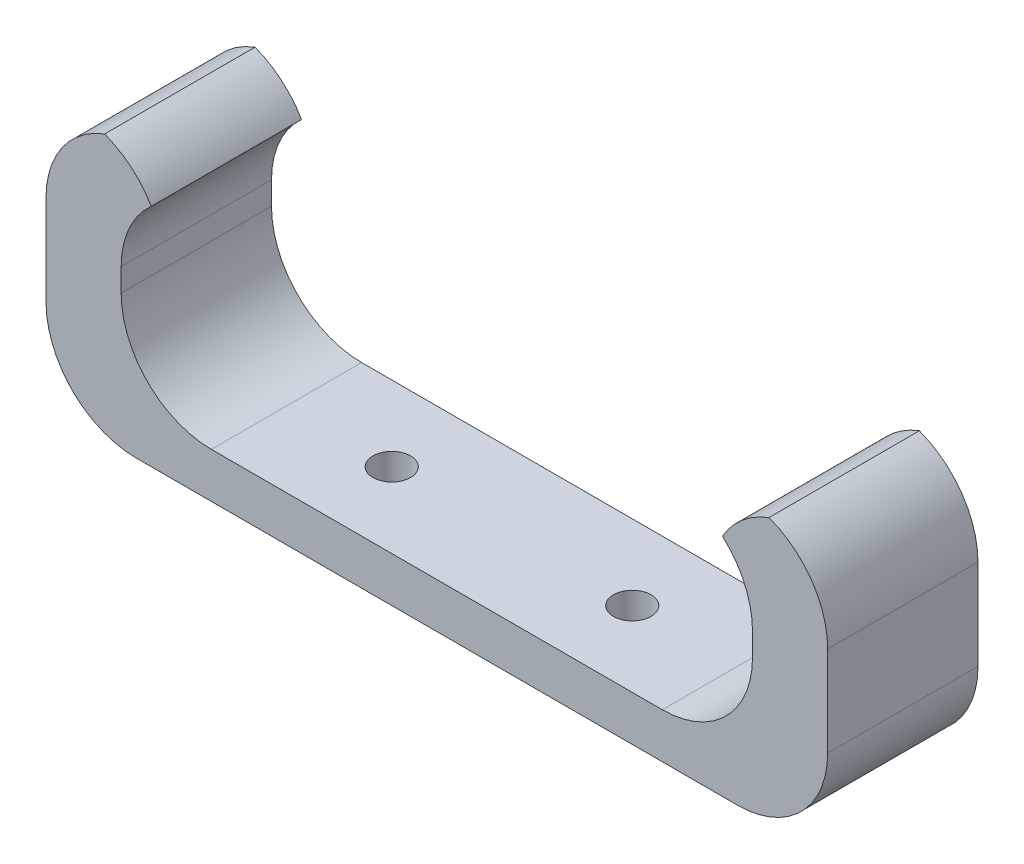
from build123d import *

# Parameters (mm, degrees)
SKETCH1_W           = 42
SKETCH1_H           = 10
SKETCH1_R           = 1.25
BOSS_EXTRUDE1_DEPTH = 3
SKETCH2_W           = 5
SKETCH2_H           = 10
BOSS_EXTRUDE2_DEPTH = 18
SKETCH3_W           = 10
SKETCH3_H           = 3
BOSS_EXTRUDE3_DEPTH = 2
SKETCH4_W           = 10
SKETCH4_H           = 3
BOSS_EXTRUDE4_DEPTH = 2
FILLET1_R           = 6


with BuildPart() as part:
    # Sketch1 → Boss-Extrude1 (new body)
    with BuildSketch(Plane(origin=(0, 0, 0), x_dir=(1, 0, 0), z_dir=(0, 1, 0))):
        with Locations((8, 0)):
            Rectangle(SKETCH1_W, SKETCH1_H)
        with Locations(Location((0, 0, 0), (0, 0, 270))):
            Circle(SKETCH1_R, mode=Mode.SUBTRACT)
        with Locations(Location((16, 0, 0), (0, 0, 270))):
            Circle(SKETCH1_R, mode=Mode.SUBTRACT)
    extrude(amount=BOSS_EXTRUDE1_DEPTH)

    # Sketch2 → Boss-Extrude2 (add)
    with BuildSketch(Plane.XZ):
        with Locations((-15.5, 0)):
            Rectangle(SKETCH2_W, SKETCH2_H)
        with Locations((31.5, 0)):
            Rectangle(SKETCH2_W, SKETCH2_H)
    extrude(amount=-BOSS_EXTRUDE2_DEPTH)

    # Sketch3 → Boss-Extrude3 (add)
    with BuildSketch(Plane(origin=(-13, 0, 0), x_dir=(0, 0, -1), z_dir=(1, 0, 0))):
        with Locations((0, 16.5)):
            Rectangle(SKETCH3_W, SKETCH3_H)
    extrude(amount=BOSS_EXTRUDE3_DEPTH)

    # Sketch4 → Boss-Extrude4 (add)
    with BuildSketch(Plane.ZY.offset(-29)):
        with Locations((0, 16.5)):
            Rectangle(SKETCH4_W, SKETCH4_H)
    extrude(amount=BOSS_EXTRUDE4_DEPTH)

    # Fillet1
    # the kernel refuses this fillet: 6 mm, written as the material it adds along each edge
    with BuildSketch(Plane(origin=(29, 15, 5), x_dir=(-1, 0, 0), z_dir=(0, 0, -1))) as fillet1_piece_1:
        with BuildLine():
            CenterArc((6, -4.472135955), FILLET1_R, 131.810314896, 48.189685104)
            Line((0, -4.472135955), (-0.12, -4.472135955))
            Line((-0.12, -4.472135955), (-0.12, 0))
            Line((-0.12, 0), (0, 0.12))
            ThreePointArc((0, 0.12), (1, 0.12), (1.92, 0.089442719))
            Line((1.92, 0.089442719), (2, 0))
        make_face()
    extrude(amount=10)
    with BuildSketch(Plane(origin=(29, 3, 5), x_dir=(0, 1, 0), z_dir=(0, 0, -1))) as fillet1_piece_2:
        with BuildLine():
            CenterArc((FILLET1_R, -FILLET1_R), FILLET1_R, 90, 90)
            Line((0, -FILLET1_R), (-FILLET1_R * 0.02, -FILLET1_R))
            Line((-FILLET1_R * 0.02, -FILLET1_R), (-FILLET1_R * 0.02, FILLET1_R * 0.02))
            Line((-FILLET1_R * 0.02, FILLET1_R * 0.02), (FILLET1_R, FILLET1_R * 0.02))
            Line((FILLET1_R, FILLET1_R * 0.02), (FILLET1_R, 0))
        make_face()
    extrude(amount=10)
    with BuildSketch(Plane(origin=(-13, 15, -5), x_dir=(0, -1, 0), z_dir=(0, 0, 1))) as fillet1_piece_3:
        with BuildLine():
            CenterArc((4.472135955, 6), FILLET1_R, 221.810314896, 48.189685104)
            Line((0, 2), (-0.089442719, 1.92))
            ThreePointArc((-0.089442719, 1.92), (-0.12, 1), (-0.12, 0))
            Line((-0.12, 0), (0, -0.12))
            Line((0, -0.12), (4.472135955, -0.12))
            Line((4.472135955, -0.12), (4.472135955, 0))
        make_face()
    extrude(amount=10)
    with BuildSketch(Plane(origin=(-13, 3, -5), x_dir=(1, 0, 0), z_dir=(0, 0, 1))) as fillet1_piece_4:
        with BuildLine():
            CenterArc((FILLET1_R, FILLET1_R), FILLET1_R, 180, 90)
            Line((0, FILLET1_R), (-FILLET1_R * 0.02, FILLET1_R))
            Line((-FILLET1_R * 0.02, FILLET1_R), (-FILLET1_R * 0.02, -FILLET1_R * 0.02))
            Line((-FILLET1_R * 0.02, -FILLET1_R * 0.02), (FILLET1_R, -FILLET1_R * 0.02))
            Line((FILLET1_R, -FILLET1_R * 0.02), (FILLET1_R, 0))
        make_face()
    extrude(amount=10)
    # the kernel refuses this fillet: 6 mm, written as the material it takes off along each edge
    with BuildSketch(Plane(origin=(-18, 0, -20), x_dir=(1, 0, 0), z_dir=(0, 0, 1))) as fillet1_2_piece_1:
        with BuildLine():
            CenterArc((FILLET1_R, FILLET1_R), FILLET1_R, 180, 90)
            Line((0, FILLET1_R), (-FILLET1_R * 0.02, FILLET1_R))
            Line((-FILLET1_R * 0.02, FILLET1_R), (-FILLET1_R * 0.02, -FILLET1_R * 0.02))
            Line((-FILLET1_R * 0.02, -FILLET1_R * 0.02), (FILLET1_R, -FILLET1_R * 0.02))
            Line((FILLET1_R, -FILLET1_R * 0.02), (FILLET1_R, 0))
        make_face()
    extrude(amount=40, mode=Mode.SUBTRACT)
    with BuildSketch(Plane(origin=(-18, 18, -20), x_dir=(1, 0, 0), z_dir=(0, 0, 1)), Plane(origin=(34, 0, -20), x_dir=(-1, 0, 0), z_dir=(0, 0, 1)), Plane(origin=(34, 18, -20), x_dir=(0, -1, 0), z_dir=(0, 0, 1))) as fillet1_2_piece_2:
        with BuildLine():
            CenterArc((FILLET1_R, -FILLET1_R), FILLET1_R, 90, 90)
            Line((0, -FILLET1_R), (-FILLET1_R * 0.02, -FILLET1_R))
            Line((-FILLET1_R * 0.02, -FILLET1_R), (-FILLET1_R * 0.02, FILLET1_R * 0.02))
            Line((-FILLET1_R * 0.02, FILLET1_R * 0.02), (FILLET1_R, FILLET1_R * 0.02))
            Line((FILLET1_R, FILLET1_R * 0.02), (FILLET1_R, 0))
        make_face()
    extrude(amount=40, mode=Mode.SUBTRACT)
    with BuildSketch(Plane(origin=(27, 18, -17.990381057), x_dir=(1, 0, 0), z_dir=(0, 0, 1))) as fillet1_2_piece_3:
        with BuildLine():
            CenterArc((5.196152423, -6), FILLET1_R, 90, 60)
            Line((0, -3), (-0.103923048, -2.94))
            ThreePointArc((-0.103923048, -2.94), (-0.12, -1.5), (-0.12, 0))
            Line((-0.12, 0), (0, 0.12))
            Line((0, 0.12), (5.196152423, 0.12))
            Line((5.196152423, 0.12), (5.196152423, 0))
        make_face()
    extrude(amount=35.980762114, mode=Mode.SUBTRACT)
    with BuildSketch(Plane(origin=(-11, 18, 17.990381057), x_dir=(0, -1, 0), z_dir=(0, 0, -1))) as fillet1_2_piece_4:
        with BuildLine():
            CenterArc((6, 5.196152423), FILLET1_R, 180, 60)
            Line((0, 5.196152423), (-0.12, 5.196152423))
            Line((-0.12, 5.196152423), (-0.12, 0))
            Line((-0.12, 0), (0, -0.12))
            ThreePointArc((0, -0.12), (1.5, -0.12), (2.94, -0.103923048))
            Line((2.94, -0.103923048), (3, 0))
        make_face()
    extrude(amount=35.980762114, mode=Mode.SUBTRACT)


solid = part.part
